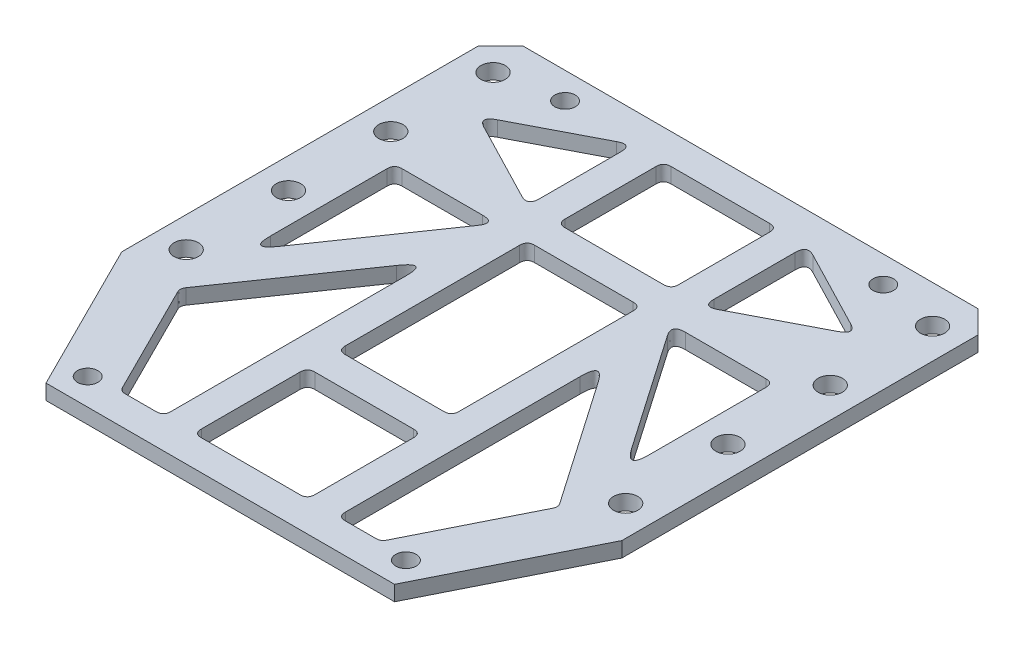
from build123d import *

# Parameters (mm, degrees)
SKETCH_1_W          = 66
SKETCH_1_H          = 70
SKETCH_1_R          = 1.35
SKETCH_1_R_2        = 1.6
EXTRUDE_1_DEPTH     = 2
SKETCH_2_W          = 15
SKETCH_2_H          = 15
SKETCH_2_H_2        = 25
SKETCH_2_H_3        = 14
CUT_EXTRUDE_1_DEPTH = 49.145612469
CHAMFER_1_SIZE      = 3
FILLET_1_SIZE       = 1


with BuildPart() as part:
    # 草图1 → 凸台-拉伸1 (new body)
    with BuildSketch(Plane(origin=(0, 0, 0), x_dir=(1, 0, 0), z_dir=(0, 1, 0))):
        Rectangle(SKETCH_1_W, SKETCH_1_H)
        with Locations(Location((-21, 31.5, 0), (0, 0, 270))):
            Circle(SKETCH_1_R, mode=Mode.SUBTRACT)
        with Locations(Location((21, 31.5, 0), (0, 0, 90))):
            Circle(SKETCH_1_R, mode=Mode.SUBTRACT)
        with Locations(Location((21, -31.5, 0), (0, 0, 270))):
            Circle(SKETCH_1_R, mode=Mode.SUBTRACT)
        with Locations(Location((-21, -31.5, 0), (0, 0, 90))):
            Circle(SKETCH_1_R, mode=Mode.SUBTRACT)
        with Locations(Location((-29, 30, 0), (0, 0, 270))):
            Circle(SKETCH_1_R_2, mode=Mode.SUBTRACT)
        with Locations(Location((-29, 16.5, 0), (0, 0, 270))):
            Circle(SKETCH_1_R_2, mode=Mode.SUBTRACT)
        with Locations(Location((-29, 3, 0), (0, 0, 270))):
            Circle(SKETCH_1_R_2, mode=Mode.SUBTRACT)
        with Locations(Location((-29, -10.5, 0), (0, 0, 270))):
            Circle(SKETCH_1_R_2, mode=Mode.SUBTRACT)
        with Locations(Location((29, -10.5, 0), (0, 0, 90))):
            Circle(SKETCH_1_R_2, mode=Mode.SUBTRACT)
        with Locations(Location((29, 3, 0), (0, 0, 90))):
            Circle(SKETCH_1_R_2, mode=Mode.SUBTRACT)
        with Locations(Location((29, 16.5, 0), (0, 0, 90))):
            Circle(SKETCH_1_R_2, mode=Mode.SUBTRACT)
        with Locations(Location((29, 30, 0), (0, 0, 90))):
            Circle(SKETCH_1_R_2, mode=Mode.SUBTRACT)
    extrude(amount=EXTRUDE_1_DEPTH)

    # 草图2 → 切除-拉伸1 (cut, through all)
    with BuildSketch(Plane(origin=(0, 2, 0), x_dir=(1, 0, 0), z_dir=(0, 1, 0))):
        Polygon((-33, -15), (-33, -35), (-23, -35), align=None)
        Polygon((33, -35), (23, -35), (33, -15), align=None)
        Polygon((-11.5, 4.201086665), (-11.5, -31), (-17.173762079, -31), (-25, -15.347524158), align=None)
        with Locations((0, -23.5)):
            Rectangle(SKETCH_2_W, SKETCH_2_H)
        with Locations((0, 0.5)):
            Rectangle(SKETCH_2_W, SKETCH_2_H_2)
        with Locations((0, 24)):
            Rectangle(SKETCH_2_W, SKETCH_2_H_3)
        Polygon((-11.5, 13), (-25, -6.548610823), (-25, 13), align=None)
        Polygon((-11.5, 31), (-11.5, 17), (-25, 24), align=None)
        Polygon((11.5, -31), (17.173762079, -31), (25, -15.347524158), (11.5, 4.201086665), align=None)
        Polygon((25, -6.548610823), (25, 13), (11.5, 13), align=None)
        Polygon((11.5, 31), (25, 24), (11.5, 17), align=None)
    extrude(amount=-CUT_EXTRUDE_1_DEPTH, mode=Mode.SUBTRACT)

    # 倒角1
    chamfer_1_edges = [part.edges().sort_by_distance(p)[0] for p in [
        (-33, 1, -35),
        (33, 1, -35),
    ]]
    chamfer(chamfer_1_edges, length=CHAMFER_1_SIZE)

    # 圆角1
    # a fillet whose section is not a circle: 1 mm, written as the material it adds along each edge
    with BuildSketch(Plane(origin=(-11.5, 2, 31), x_dir=(-1, 0, 0), z_dir=(0, -1, 0)), Plane(origin=(25, 2, -13), x_dir=(0, 0, 1), z_dir=(0, -1, 0)), Plane(origin=(7.5, 2, -31), x_dir=(0, 0, 1), z_dir=(0, -1, 0)), Plane(origin=(7.5, 2, -13), x_dir=(0, 0, 1), z_dir=(0, -1, 0)), Plane(origin=(7.5, 2, 16), x_dir=(0, 0, 1), z_dir=(0, -1, 0))) as fillet_1_piece_1:
        with BuildLine():
            Bezier((FILLET_1_SIZE, 0), (0, 0), (0, FILLET_1_SIZE), weights=[1, 1, 1])
            Line((0, FILLET_1_SIZE), (0, 0))
            Line((0, 0), (FILLET_1_SIZE, 0))
        make_face()
    extrude(amount=2)
    with BuildSketch(Plane(origin=(-25, 2, 15.347524158), x_dir=(0.44721359549995915, 0, 0.8944271909999153), z_dir=(0, -1, 0)), Plane(origin=(25, 2, 15.347524158), x_dir=(-0.5682519886051801, 0, -0.822854590706194), z_dir=(0, -1, 0))) as fillet_1_piece_2:
        with BuildLine():
            Bezier((0.591321468, 0), (0, 0), (-0.284930322, -0.518146495), weights=[1, 1, 1])
            Line((-0.284930322, -0.518146495), (0, 0))
            Line((0, 0), (0.591321468, 0))
        make_face()
    extrude(amount=2)
    with BuildSketch(Plane(origin=(-17.173762079, 2, 31), x_dir=(1, 0, 0), z_dir=(0, -1, 0))) as fillet_1_piece_3:
        with BuildLine():
            Bezier((0.618033989, 0), (0, 0), (-0.276393202, -0.552786405), weights=[1, 1, 1])
            Line((-0.276393202, -0.552786405), (0, 0))
            Line((0, 0), (0.618033989, 0))
        make_face()
    extrude(amount=2)
    with BuildSketch(Plane(origin=(-11.5, 2, -4.201086665), x_dir=(-0.5682519886051809, 0, 0.8228545907061935), z_dir=(0, -1, 0)), Plane(origin=(11.5, 2, -4.201086665), x_dir=(0, 0, 1), z_dir=(0, -1, 0)), Plane(origin=(25, 2, 6.548610823), x_dir=(0, 0, -1), z_dir=(0, -1, 0))) as fillet_1_piece_4:
        with BuildLine():
            Bezier((3.207827913, 0), (0, 0), (2.639575924, -1.822854591), weights=[1, 1, 1])
            Line((2.639575924, -1.822854591), (0, 0))
            Line((0, 0), (3.207827913, 0))
        make_face()
    extrude(amount=2)
    with BuildSketch(Plane(origin=(-25, 2, 6.548610823), x_dir=(0, 0, -1), z_dir=(0, -1, 0))) as fillet_1_piece_5:
        with BuildLine():
            Bezier((3.207827913, 0), (0, 0), (2.639575924, 1.822854591), weights=[1, 1, 1])
            Line((2.639575924, 1.822854591), (0, 0))
            Line((0, 0), (3.207827913, 0))
        make_face()
    extrude(amount=2)
    with BuildSketch(Plane(origin=(-11.5, 2, -13), x_dir=(-1, 0, 0), z_dir=(0, -1, 0)), Plane(origin=(11.5, 2, -13), x_dir=(0.568251988605183, 0, 0.822854590706192), z_dir=(0, -1, 0))) as fillet_1_piece_6:
        with BuildLine():
            Bezier((1.905867703, 0), (0, 0), (1.083013112, -1.568251989), weights=[1, 1, 1])
            Line((1.083013112, -1.568251989), (0, 0))
            Line((0, 0), (1.905867703, 0))
        make_face()
    extrude(amount=2)
    with BuildSketch(Plane(origin=(-25, 2, -13), x_dir=(0, 0, 1), z_dir=(0, -1, 0)), Plane(origin=(11.5, 2, 31), x_dir=(1, 0, 0), z_dir=(0, -1, 0)), Plane(origin=(7.5, 2, -17), x_dir=(0, 0, -1), z_dir=(0, -1, 0)), Plane(origin=(-7.5, 2, -31), x_dir=(0, 0, 1), z_dir=(0, -1, 0)), Plane(origin=(-7.5, 2, -17), x_dir=(1, 0, 0), z_dir=(0, -1, 0)), Plane(origin=(-7.5, 2, -13), x_dir=(0, 0, 1), z_dir=(0, -1, 0)), Plane(origin=(-7.5, 2, 12), x_dir=(1, 0, 0), z_dir=(0, -1, 0)), Plane(origin=(7.5, 2, 12), x_dir=(0, 0, -1), z_dir=(0, -1, 0)), Plane(origin=(7.5, 2, 31), x_dir=(0, 0, -1), z_dir=(0, -1, 0)), Plane(origin=(-7.5, 2, 31), x_dir=(1, 0, 0), z_dir=(0, -1, 0)), Plane(origin=(-7.5, 2, 16), x_dir=(0, 0, 1), z_dir=(0, -1, 0))) as fillet_1_piece_7:
        with BuildLine():
            Bezier((FILLET_1_SIZE, 0), (0, 0), (0, -FILLET_1_SIZE), weights=[1, 1, 1])
            Line((0, -FILLET_1_SIZE), (0, 0))
            Line((0, 0), (FILLET_1_SIZE, 0))
        make_face()
    extrude(amount=2)
    with BuildSketch(Plane(origin=(-11.5, 2, -17), x_dir=(-0.887754531448929, 0, -0.46031716445500115), z_dir=(0, -1, 0))) as fillet_1_piece_8:
        with BuildLine():
            Bezier((1.644956024, 0), (0, 0), (0.757201493, 1.460317164), weights=[1, 1, 1])
            Line((0.757201493, 1.460317164), (0, 0))
            Line((0, 0), (1.644956024, 0))
        make_face()
    extrude(amount=2)
    with BuildSketch(Plane(origin=(-11.5, 2, -31), x_dir=(-0.887754531448929, 0, 0.46031716445500115), z_dir=(0, -1, 0)), Plane(origin=(11.5, 2, -17), x_dir=(0.8877545314489292, 0, -0.46031716445500076), z_dir=(0, -1, 0)), Plane(origin=(11.5, 2, -31), x_dir=(0, 0, 1), z_dir=(0, -1, 0))) as fillet_1_piece_9:
        with BuildLine():
            Bezier((1.644956024, 0), (0, 0), (0.757201493, -1.460317164), weights=[1, 1, 1])
            Line((0.757201493, -1.460317164), (0, 0))
            Line((0, 0), (1.644956024, 0))
        make_face()
    extrude(amount=2)
    with BuildSketch(Plane(origin=(-25, 2, -24), x_dir=(0.8877545314489294, 0, 0.46031716445500037), z_dir=(0, -1, 0))) as fillet_1_piece_10:
        with BuildLine():
            Bezier((1.928571429, 0), (0, 0), (1.111274131, -1.576216216), weights=[1, 1, 1])
            Line((1.111274131, -1.576216216), (0, 0))
            Line((0, 0), (1.928571429, 0))
        make_face()
    extrude(amount=2)
    with BuildSketch(Plane(origin=(17.173762079, 2, 31), x_dir=(-1, 0, 0), z_dir=(0, -1, 0))) as fillet_1_piece_11:
        with BuildLine():
            Bezier((0.618033989, 0), (0, 0), (-0.276393202, 0.552786405), weights=[1, 1, 1])
            Line((-0.276393202, 0.552786405), (0, 0))
            Line((0, 0), (0.618033989, 0))
        make_face()
    extrude(amount=2)
    with BuildSketch(Plane(origin=(25, 2, -24), x_dir=(-0.8877545314489294, 0, 0.46031716445500037), z_dir=(0, -1, 0))) as fillet_1_piece_12:
        with BuildLine():
            Bezier((1.928571429, 0), (0, 0), (1.111274131, 1.576216216), weights=[1, 1, 1])
            Line((1.111274131, 1.576216216), (0, 0))
            Line((0, 0), (1.928571429, 0))
        make_face()
    extrude(amount=2)


solid = part.part
